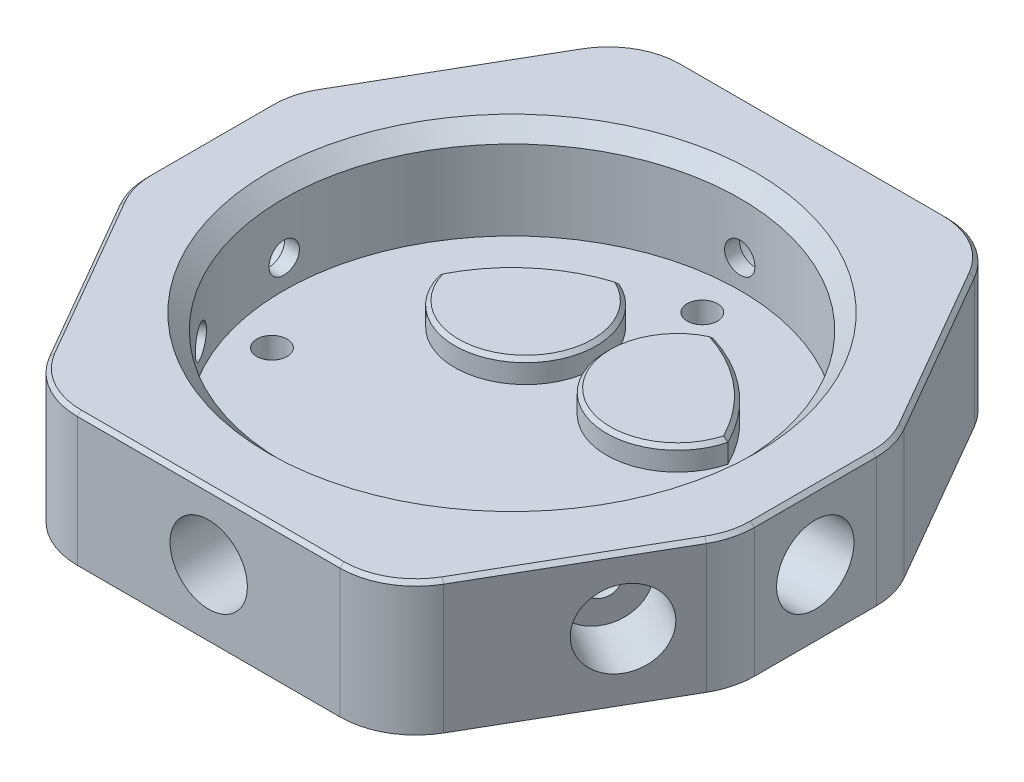
from build123d import *

# Parameters (mm, degrees)
SKETCH1_W               = 101.6
SKETCH1_H               = 101.6
SKETCH1_R               = 38.394
SKETCH1_R_2             = 3.175
SKETCH1_R_3             = 11.8745
SKETCH1_R_4             = 4.1275
BOSS_EXTRUDE1_DEPTH     = 6.35
SKETCH2_W               = 101.6
SKETCH2_H               = 101.6
SKETCH2_R               = 38.227
BOSS_EXTRUDE2_DEPTH     = 15.875
BOSS_EXTRUDE3_DEPTH     = 3.81
SKETCH8_R               = 6.477
CUT_EXTRUDE1_DEPTH      = 10.16
CUT_EXTRUDE5_DEPTH      = 76.201267443
CIRPATTERN1_START       = 40.64
CIRPATTERN1_OUTLINE_R   = 6.477
CIRPATTERN1_DEPTH       = 10.16
CIRPATTERN1_START_2     = -50.8
CIRPATTERN1_2_OUTLINE_R = 6.477
CIRPATTERN1_2_DEPTH     = 10.16
CIRPATTERN1_3_OUTLINE_R = 6.477
CIRPATTERN1_3_DEPTH     = 10.16
CIRPATTERN1_4_OUTLINE_R = 6.477
CIRPATTERN1_4_DEPTH     = 10.16
CIRPATTERN1_5_OUTLINE_R = 6.477
CIRPATTERN1_5_DEPTH     = 10.16
SKETCH13_R              = 2.54
CUT_EXTRUDE4_DEPTH      = 17.272
CIRPATTERN4_START       = 38.142521171
CIRPATTERN4_OUTLINE_R   = 2.54
CIRPATTERN4_DEPTH       = 2.497478829
CIRPATTERN4_START_2     = -40.64
CIRPATTERN4_2_OUTLINE_R = 2.54
CIRPATTERN4_2_DEPTH     = 81.28
CIRPATTERN4_3_OUTLINE_R = 2.54
CIRPATTERN4_3_DEPTH     = 2.497478829
CIRPATTERN4_4_OUTLINE_R = 2.54
CIRPATTERN4_4_DEPTH     = 2.497478829
SKETCH12_R              = 2.54
CUT_EXTRUDE3_DEPTH      = 74.575101958
FILLET1_R               = 12.7
CHAMFER1_SIZE           = 2.54
CHAMFER2_SIZE           = 0.635
CHAMFER3_SIZE           = 0.635


# Read off the part's stored shape, not the designer's step: Boss-Extrude3, CirPattern1, CirPattern4
with BuildPart() as part:
    # Sketch1 → Boss-Extrude1 (new body)
    # profile 1 of 9: a face of its own
    with BuildSketch(Plane(origin=(0, 0, 0), x_dir=(1, 0, 0), z_dir=(0, 1, 0))):
        Rectangle(SKETCH1_W, SKETCH1_H)
        Circle(SKETCH1_R, mode=Mode.SUBTRACT)
    # profile 2 of 9: a face of its own
    with BuildSketch(Plane(origin=(0, 0, 0), x_dir=(1, 0, 0), z_dir=(0, 1, 0))):
        Circle(SKETCH1_R)
        with Locations((0, 30.226)):
            Circle(SKETCH1_R_2, mode=Mode.SUBTRACT)
        with Locations((12.7, 20.066)):
            Circle(SKETCH1_R_3, mode=Mode.SUBTRACT)
        with Locations((0, 9.906)):
            Circle(SKETCH1_R_2, mode=Mode.SUBTRACT)
        with Locations((0, -14.605)):
            Circle(SKETCH1_R_4, mode=Mode.SUBTRACT)
        with Locations((-12.7, 20.066)):
            Circle(SKETCH1_R_3, mode=Mode.SUBTRACT)
        with Locations((25.4, 2.6162)):
            Circle(SKETCH1_R_2, mode=Mode.SUBTRACT)
        with Locations((-25.4, 2.6162)):
            Circle(SKETCH1_R_2, mode=Mode.SUBTRACT)
    # profile 3 of 9: a face of its own
    with BuildSketch(Plane(origin=(0, 0, 0), x_dir=(1, 0, 0), z_dir=(0, 1, 0))):
        with Locations((-25.4, 2.6162)):
            Circle(SKETCH1_R_2)
    # profile 4 of 9: a face of its own
    with BuildSketch(Plane(origin=(0, 0, 0), x_dir=(1, 0, 0), z_dir=(0, 1, 0))):
        with Locations((0, 9.906)):
            Circle(SKETCH1_R_2)
    # profile 5 of 9: a face of its own
    with BuildSketch(Plane(origin=(0, 0, 0), x_dir=(1, 0, 0), z_dir=(0, 1, 0))):
        with Locations((0, 30.226)):
            Circle(SKETCH1_R_2)
    # profile 6 of 9: a face of its own
    with BuildSketch(Plane(origin=(0, 0, 0), x_dir=(1, 0, 0), z_dir=(0, 1, 0))):
        with Locations((12.7, 20.066)):
            Circle(SKETCH1_R_3)
    # profile 7 of 9: a face of its own
    with BuildSketch(Plane(origin=(0, 0, 0), x_dir=(1, 0, 0), z_dir=(0, 1, 0))):
        with Locations((-12.7, 20.066)):
            Circle(SKETCH1_R_3)
    # profile 8 of 9: a face of its own
    with BuildSketch(Plane(origin=(0, 0, 0), x_dir=(1, 0, 0), z_dir=(0, 1, 0))):
        with Locations((0, -14.605)):
            Circle(SKETCH1_R_4)
    # profile 9 of 9: a face of its own
    with BuildSketch(Plane(origin=(0, 0, 0), x_dir=(1, 0, 0), z_dir=(0, 1, 0))):
        with Locations((25.4, 2.6162)):
            Circle(SKETCH1_R_2)
    extrude(amount=BOSS_EXTRUDE1_DEPTH)

    # Sketch2 → Boss-Extrude2 (add)
    with BuildSketch(Plane(origin=(0, 6.35, 0), x_dir=(1, 0, 0), z_dir=(0, 1, 0))):
        Rectangle(SKETCH2_W, SKETCH2_H)
        with Locations(Location((0, 0, 0), (0, 0, 270))):
            Circle(SKETCH2_R, mode=Mode.SUBTRACT)
    extrude(amount=BOSS_EXTRUDE2_DEPTH)

    # Boss-Extrude3 outline → Boss-Extrude3 (add)
    with BuildSketch(Plane(origin=(0, 6.35, 0), x_dir=(1, 0, 0), z_dir=(0, 1, 0))):
        with BuildLine():
            ThreePointArc((-24.172458524, 12.000725193), (-5.035808562, 5.942254103), (-7.873448726, 25.813445361))
            ThreePointArc((-7.873448726, 25.813445361), (-17.448004255, 20.58864502), (-24.172458524, 12.000725193))
        make_face()
        with BuildLine():
            ThreePointArc((24.172458524, 12.000725193), (17.448004255, 20.58864502), (7.873448726, 25.813445361))
            ThreePointArc((7.873448726, 25.813445361), (5.035808562, 5.942254103), (24.172458524, 12.000725193))
        make_face()
    extrude(amount=BOSS_EXTRUDE3_DEPTH)

    # Sketch8 → Cut-Extrude1 (cut)
    with BuildSketch(Plane(origin=(0, 0, -50.8), x_dir=(-1, 0, 0), z_dir=(0, 0, -1))):
        with Locations((0, 11.1125)):
            Circle(SKETCH8_R)
    extrude(amount=-CUT_EXTRUDE1_DEPTH, mode=Mode.SUBTRACT)

    # Sketch15 → Cut-Extrude5 (cut, through all)
    with BuildSketch(Plane(origin=(0, 22.225, 0), x_dir=(1, 0, 0), z_dir=(0, 1, 0))):
        Polygon((-50.8, 13.611818976), (-29.329393675, 50.8), (-50.8, 50.8), align=None)
        Polygon((-58.65878735, 0), (-50.8, 13.611818976), (-50.8, 50.8), (-58.65878735, 50.8), align=None)
        Polygon((-50.8, -13.611818976), (-50.8, 13.611818976), (-58.65878735, 0), align=None)
        Polygon((-50.8, -13.611818976), (-58.65878735, 0), (-58.65878735, -50.8), (-50.8, -50.8), align=None)
        Polygon((-29.329393675, -50.8), (-50.8, -13.611818976), (-50.8, -50.8), align=None)
        Polygon((50.8, -50.8), (50.8, -13.611818976), (29.329393675, -50.8), align=None)
        Polygon((58.65878735, -50.8), (58.65878735, 0), (50.8, -13.611818976), (50.8, -50.8), align=None)
        Polygon((58.65878735, 0), (50.8, 13.611818976), (50.8, -13.611818976), align=None)
        Polygon((50.8, 50.8), (50.8, 13.611818976), (58.65878735, 0), (58.65878735, 50.8), align=None)
        Polygon((50.8, 50.8), (29.329393675, 50.8), (50.8, 13.611818976), align=None)
    extrude(amount=-CUT_EXTRUDE5_DEPTH, mode=Mode.SUBTRACT)

    # CirPattern1 outline → CirPattern1 (cut)
    with BuildSketch(Plane.XY.offset(CIRPATTERN1_START)):
        with Locations((0, 11.1125)):
            Circle(CIRPATTERN1_OUTLINE_R)
    extrude(amount=CIRPATTERN1_DEPTH, mode=Mode.SUBTRACT)

    # CirPattern1 2 outline → CirPattern1 2 (cut)
    with BuildSketch(Plane(origin=(0, 0, 0), x_dir=(0.49999999999999195, 0, 0.8660254037844434), z_dir=(0.8660254037844433, 0, -0.4999999999999921)).offset(CIRPATTERN1_START_2)):
        with Locations((0, -11.1125)):
            Circle(CIRPATTERN1_2_OUTLINE_R)
    extrude(amount=CIRPATTERN1_2_DEPTH, mode=Mode.SUBTRACT)

    # CirPattern1 3 outline → CirPattern1 3 (cut)
    with BuildSketch(Plane(origin=(0, 0, 0), x_dir=(0.500000000000004, 0, -0.8660254037844363), z_dir=(0.8660254037844363, 0, 0.5000000000000042)).offset(CIRPATTERN1_START)):
        with Locations((0, 11.1125)):
            Circle(CIRPATTERN1_3_OUTLINE_R)
    extrude(amount=CIRPATTERN1_3_DEPTH, mode=Mode.SUBTRACT)

    # CirPattern1 4 outline → CirPattern1 4 (cut)
    with BuildSketch(Plane.YZ.offset(CIRPATTERN1_START_2)):
        with Locations((11.1125, 0)):
            Circle(CIRPATTERN1_4_OUTLINE_R)
    extrude(amount=CIRPATTERN1_4_DEPTH, mode=Mode.SUBTRACT)

    # CirPattern1 5 outline → CirPattern1 5 (cut)
    with BuildSketch(Plane.YZ.offset(CIRPATTERN1_START)):
        with Locations((11.1125, 0)):
            Circle(CIRPATTERN1_5_OUTLINE_R)
    extrude(amount=CIRPATTERN1_5_DEPTH, mode=Mode.SUBTRACT)

    # Sketch13 → Cut-Extrude4 (cut)
    with BuildSketch(Plane(origin=(0, 0, -50.8), x_dir=(-1, 0, 0), z_dir=(0, 0, -1))):
        with Locations((0, 11.1125)):
            Circle(SKETCH13_R)
    extrude(amount=-CUT_EXTRUDE4_DEPTH, mode=Mode.SUBTRACT)

    # CirPattern4 outline → CirPattern4 (cut)
    with BuildSketch(Plane.XY.offset(CIRPATTERN4_START)):
        with Locations((0, 11.1125)):
            Circle(CIRPATTERN4_OUTLINE_R)
    extrude(amount=CIRPATTERN4_DEPTH, mode=Mode.SUBTRACT)

    # CirPattern4 2 outline → CirPattern4 2 (cut)
    with BuildSketch(Plane.YZ.offset(CIRPATTERN4_START_2)):
        with Locations((11.1125, 0)):
            Circle(CIRPATTERN4_2_OUTLINE_R)
    extrude(amount=CIRPATTERN4_2_DEPTH, mode=Mode.SUBTRACT)

    # CirPattern4 3 outline → CirPattern4 3 (cut)
    with BuildSketch(Plane(origin=(0, 0, 0), x_dir=(0.49999999999999195, 0, -0.8660254037844434), z_dir=(0.8660254037844433, 0, 0.4999999999999921)).offset(CIRPATTERN4_START)):
        with Locations((0, 11.1125)):
            Circle(CIRPATTERN4_3_OUTLINE_R)
    extrude(amount=CIRPATTERN4_3_DEPTH, mode=Mode.SUBTRACT)

    # CirPattern4 4 outline → CirPattern4 4 (cut)
    with BuildSketch(Plane(origin=(0, 0, 0), x_dir=(0.500000000000004, 0, 0.8660254037844363), z_dir=(0.8660254037844363, 0, -0.5000000000000042)).offset(CIRPATTERN4_START_2)):
        with Locations((0, -11.1125)):
            Circle(CIRPATTERN4_4_OUTLINE_R)
    extrude(amount=CIRPATTERN4_4_DEPTH, mode=Mode.SUBTRACT)

    # Sketch12 → Cut-Extrude3 (cut, through all)
    with BuildSketch(Plane(origin=(0, 6.35, 0), x_dir=(1, 0, 0), z_dir=(0, 1, 0))):
        with Locations(Location((-30.913047265, -9.296856721, 0), (0, 0, 270))):
            Circle(SKETCH12_R)
        with Locations(Location((31.335909349, -9.296856721, 0), (0, 0, 270))):
            Circle(SKETCH12_R)
        with Locations(Location((0, -32.997501828, 0), (0, 0, 270))):
            Circle(SKETCH12_R)
        with Locations(Location((0, 31.87799304, 0), (0, 0, 270))):
            Circle(SKETCH12_R)
    extrude(amount=-CUT_EXTRUDE3_DEPTH, mode=Mode.SUBTRACT)

    # Fillet1
    fillet1_edges = [part.edges().sort_by_distance(p)[0] for p in [
        (-29.329393675, 11.1125, -50.8),
        (-50.8, 11.1125, -13.611818976),
        (-50.8, 11.1125, 13.611818976),
        (-29.329393675, 11.1125, 50.8),
        (29.329393675, 11.1125, -50.8),
        (29.329393675, 11.1125, 50.8),
        (50.8, 11.1125, 13.611818976),
        (50.8, 11.1125, -13.611818976),
    ]]
    fillet(fillet1_edges, radius=FILLET1_R)

    # Chamfer1
    chamfer1_edges = [part.edges().sort_by_distance(p)[0] for p in [
        (0, 22.225, -38.227),
    ]]
    chamfer(chamfer1_edges, length=CHAMFER1_SIZE)

    # Chamfer2
    chamfer2_edges = [part.edges().sort_by_distance(p)[0] for p in [
        (-5.035808562, 10.16, -5.942254103),
        (-17.448004255, 10.16, -20.58864502),
        (5.035808562, 10.16, -5.942254103),
        (17.448004255, 10.16, -20.58864502),
    ]]
    chamfer(chamfer2_edges, length=CHAMFER2_SIZE)

    # Chamfer3
    chamfer3_edges = [part.edges().sort_by_distance(p)[0] for p in [
        (-41.047045256, 22.225, 30.504432116),
        (0, 22.225, -50.8),
        (-41.047045256, 22.225, -30.504432116),
        (-50.8, 22.225, 0),
        (0, 22.225, 50.8),
        (41.047045256, 22.225, 30.504432116),
        (50.8, 22.225, 0),
        (41.047045256, 22.225, -30.504432116),
        (28.347045256, 22.225, 49.098522628),
        (50.367257994, 22.225, 13.495866104),
        (50.367257994, 22.225, -13.495866104),
        (28.347045256, 22.225, -49.098522628),
        (-28.347045256, 22.225, -49.098522628),
        (-50.367257994, 22.225, -13.495866104),
        (-50.367257994, 22.225, 13.495866104),
        (-28.347045256, 22.225, 49.098522628),
    ]]
    chamfer(chamfer3_edges, length=CHAMFER3_SIZE)


solid = part.part
